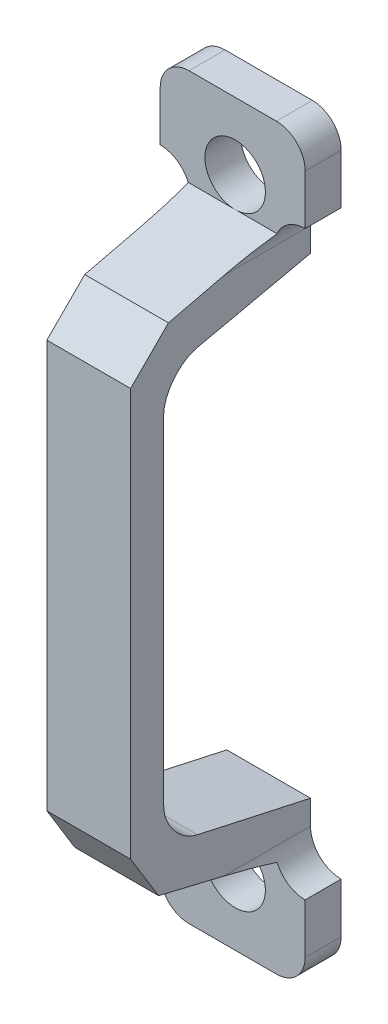
from build123d import *
from OCP.BRepFilletAPI import BRepFilletAPI_MakeChamfer

# Parameters (mm, degrees)
SKETCH_1_W               = 10.068208361
SKETCH_1_H               = 51.310344827
SKETCH_1_R               = 2.1
EXTRUDE_1_DEPTH          = 2.5
EXTRUDE_2_REACH          = 83.327
CUT_EXTRUDE_1_DEPTH      = 83.243670079
CUT_EXTRUDE_1_DEPTH_BACK = 83.243670079
CUT_EXTRUDE_2_DEPTH      = 122.121367623
CUT_EXTRUDE_2_DEPTH_BACK = 122.121367623
FILLET_2_R               = 2
CHAMFER_2_SIZE           = 2
CHAMFER_2_SIZE2          = 2.70532723


with BuildPart() as part:
    # 草图1 → 凸台-拉伸1 (new body)
    with BuildSketch(Plane.XY):
        with Locations((84.451834639, -55.007101597)):
            Rectangle(SKETCH_1_W, SKETCH_1_H)
        with Locations((84.623869854, -34.007101596)):
            Circle(SKETCH_1_R, mode=Mode.SUBTRACT)
        with Locations((84.623869854, -76.007101596)):
            Circle(SKETCH_1_R, mode=Mode.SUBTRACT)
    extrude(amount=EXTRUDE_1_DEPTH)

    # 凸台-拉伸2: up to this face of the body (flat: up to its plane)
    extrude_2_end = Plane(part.part.faces().sort_by_distance((79.417730458, -55.007101596, 1.25))[0])
    # 草图2 → 凸台-拉伸2 (add, up to the picked face)
    with BuildSketch(Plane(origin=(89.485938819, 0, 0), x_dir=(0, 0, -1), z_dir=(1, 0, 0)), mode=Mode.PRIVATE) as extrude_2_sk1:
        Polygon((-12.5, -71.517171054), (-2.5, -73.914822505), (-2.5, -36.099380688), (-12.5, -38.497032139), align=None)
    extrude_2_tool1 = split(extrude(extrude_2_sk1.sketch, amount=-EXTRUDE_2_REACH, mode=Mode.PRIVATE), bisect_by=extrude_2_end, keep=Keep.BOTH, mode=Mode.PRIVATE)
    add(extrude_2_tool1.solids().sort_by(Axis((89.485939, -55.007102, 7.387173), (-1, 0, 0)))[0])

    # 草图3 → 切除-拉伸1 (cut, two sides: drawn at the far end of the back side and taken through both)
    with BuildSketch(Plane(origin=(89.485938819, 0, 0), x_dir=(0, 0, -1), z_dir=(1, 0, 0)).offset(-CUT_EXTRUDE_1_DEPTH_BACK)):
        Polygon((-10.198786391, -69.151033694), (0, -71.395312685), (0, -38.618890508), (-10.198786391, -40.863169498), align=None)
    extrude(amount=CUT_EXTRUDE_1_DEPTH + CUT_EXTRUDE_1_DEPTH_BACK, mode=Mode.SUBTRACT)

    # 草图4 → 切除-拉伸2 (cut, two sides: drawn at the far end of the back side and taken through both)
    with BuildSketch(Plane.XY.offset(12.5).offset(-CUT_EXTRUDE_2_DEPTH_BACK)):
        with BuildLine():
            Line((81.544440974, -36.941486908), (81.544440974, -73.072716285))
            ThreePointArc((81.544440974, -73.072716285), (79.417730458, -75.199426802), (77.291019941, -73.072716285))
            Line((77.291019941, -73.072716285), (77.291019941, -36.941486908))
            ThreePointArc((77.291019941, -36.941486908), (79.417730458, -34.814776391), (81.544440974, -36.941486908))
        make_face()
        with BuildLine():
            Line((87.359228302, -36.941486908), (87.359228302, -73.072716285))
            ThreePointArc((87.359228302, -73.072716285), (89.485938819, -75.199426802), (91.612649336, -73.072716285))
            Line((91.612649336, -73.072716285), (91.612649336, -36.941486908))
            ThreePointArc((91.612649336, -36.941486908), (89.485938819, -34.814776391), (87.359228302, -36.941486908))
        make_face()
    extrude(amount=CUT_EXTRUDE_2_DEPTH + CUT_EXTRUDE_2_DEPTH_BACK, mode=Mode.SUBTRACT)

    # 圆角1
    # a fillet whose section is not a circle: 3 mm, written as the material it adds along each edge
    with BuildSketch(Plane(origin=(87.359228302, -40.863169498, 10.198786391), x_dir=(0, 0.2149116520268582, -0.9766334941128564), z_dir=(-1, 0, 0)), Plane(origin=(87.359228302, -69.151033694, 10.198786391), x_dir=(0, 1, 0), z_dir=(-1, 0, 0))) as fillet_1_piece_1:
        with BuildLine():
            Bezier((2.411616085, 0), (0, 0), (-0.518284397, 2.355265044), weights=[1, 0.666666667, 1])
            Line((-0.518284397, 2.355265044), (0, 0))
            Line((0, 0), (2.411616085, 0))
        make_face()
    extrude(amount=5.814787328)

    # 圆角2
    fillet_2_edges = [part.edges().sort_by_distance(p)[0] for p in [
        (89.485938819, -80.66227401, 1.25),
        (79.417730458, -80.66227401, 1.25),
        (79.417730458, -29.351929183, 1.25),
        (89.485938819, -29.351929183, 1.25),
    ]]
    fillet(fillet_2_edges, radius=FILLET_2_R)

    # 倒角2: one chamfer whose edges measure the first distance from different faces: ONE call of the kernel's chamfer builder (chamfer() names one face for all edges)
    chamfer_2_edges_1 = [part.edges().sort_by_distance(p)[0] for p in [
        (84.451834638, -71.517171054, 12.5),
    ]]
    chamfer_2_side_1 = [part.faces().sort_by_distance(p)[0] for p in [
        (84.451834638, -72.722762821, 7.471780545),
    ]]
    chamfer_2_edges_2 = [part.edges().sort_by_distance(p)[0] for p in [
        (84.451834638, -38.497032139, 12.5),
    ]]
    chamfer_2_side_2 = [part.faces().sort_by_distance(p)[0] for p in [
        (84.451834638, -55.007101596, 12.5),
    ]]
    chamfer_2 = BRepFilletAPI_MakeChamfer(part.part.solid().wrapped)
    for e in chamfer_2_edges_1:
        chamfer_2.Add(CHAMFER_2_SIZE, CHAMFER_2_SIZE2, e.wrapped, chamfer_2_side_1[0].wrapped)  # the first distance lies on this face
    for e in chamfer_2_edges_2:
        chamfer_2.Add(CHAMFER_2_SIZE, CHAMFER_2_SIZE2, e.wrapped, chamfer_2_side_2[0].wrapped)  # the first distance lies on this face
    add(Compound.cast(chamfer_2.Shape()), mode=Mode.REPLACE)


solid = part.part
